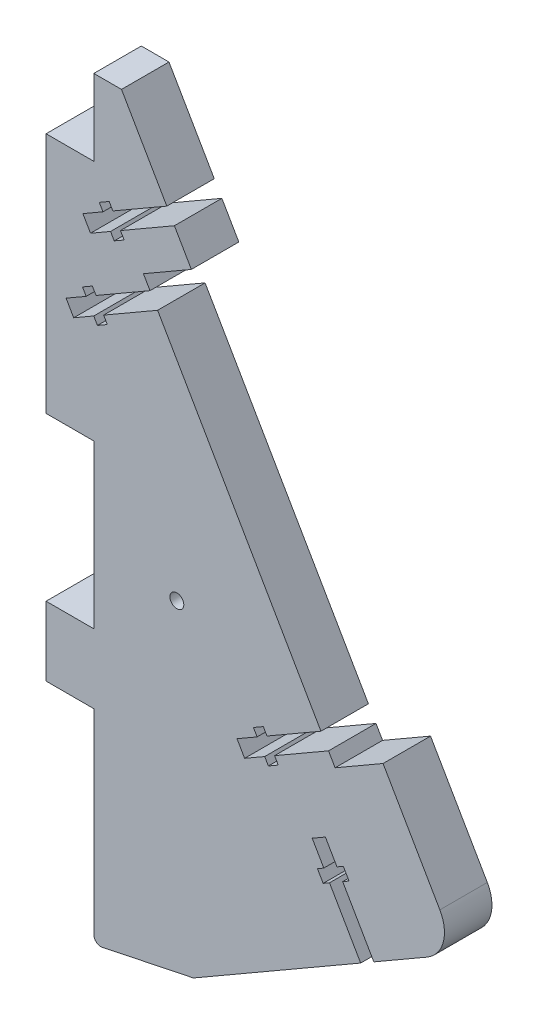
from build123d import *

# Parameters (mm, degrees)
SKETCH1_W                = 100
SKETCH1_H                = 110
BOSS_EXTRUDE1_DEPTH      = 6.86
BOSS_EXTRUDE2_DEPTH      = 6.86
CUT_EXTRUDE1_DEPTH       = 84.419927529
CUT_EXTRUDE1_DEPTH_BACK  = 84.419927529
CUT_EXTRUDE5_DEPTH       = 84.419927529
CUT_EXTRUDE6_DEPTH       = 84.419927529
SKETCH7_W                = 42
SKETCH7_H                = 3.55
CUT_EXTRUDE7_DEPTH       = 84.419927529
SKETCH8_W                = 5
SKETCH8_H                = 7.62
CUT_EXTRUDE8_DEPTH       = 84.419927529
CUT_EXTRUDE9_DEPTH       = 84.419927529
LPATTERN1_COUNT          = 2
LPATTERN1_PITCH          = 49.4
SKETCH15_W               = 6.5
SKETCH15_H               = 9.5
BOSS_EXTRUDE3_DEPTH      = 6.86
CUT_EXTRUDE14_START      = -6.86
CUT_EXTRUDE14_DEPTH      = 6.86
BOSS_EXTRUDE4_DEPTH      = 6.86
FILLET3_R                = 5
FILLET4_R                = 7
CUT_EXTRUDE11_DEPTH      = 84.419927529
BOSS_EXTRUDE5_DEPTH      = 6.86
BOSS_EXTRUDE6_DEPTH      = 6.86
CUT_EXTRUDE12_DEPTH      = 84.419927529
CUT_EXTRUDE12_DEPTH_BACK = 84.419927529
SKETCH22_R               = 1
CUT_EXTRUDE13_DEPTH      = 84.419927529
CUT_EXTRUDE15_DEPTH      = 84.419927529
CUT_EXTRUDE15_DEPTH_BACK = 84.419927529
CUT_EXTRUDE16_DEPTH      = 84.419927529
CUT_EXTRUDE16_DEPTH_BACK = 84.419927529
FILLET2_R                = 1
BOSS_EXTRUDE8_START      = -6.86
BOSS_EXTRUDE8_DEPTH      = 6.86
CUT_EXTRUDE19_START      = -10
CUT_EXTRUDE19_DEPTH      = 10
SKETCH28_W               = 6.86
SKETCH28_H               = 9.5
SKETCH28_H_2             = 35
BOSS_EXTRUDE9_DEPTH      = 0.4
BOSS_EXTRUDE10_REACH     = 81.915
SKETCH29_W               = 6.86
SKETCH29_H               = 0.5
BOSS_EXTRUDE11_DEPTH     = 6.86


# Read off the part's stored shape, not the designer's step: Cut-Extrude14
with BuildPart() as part:
    # Sketch1 → Boss-Extrude1 (new body)
    with BuildSketch(Plane.XY):
        Rectangle(SKETCH1_W, SKETCH1_H)
    extrude(amount=BOSS_EXTRUDE1_DEPTH)

    # Sketch14 → Boss-Extrude2 (add)
    with BuildSketch(Plane.XY.offset(6.86)):
        with BuildLine():
            Line((-50, 44), (-56.9, 44))
            Line((-56.9, 44), (-57.252653961, 46))
            Line((-57.252653961, 46), (-60.252653961, 46))
            ThreePointArc((-60.252653961, 46), (-62.140394827, 27.177051725), (-56.9, 9))
            Line((-56.9, 9), (-50, 9))
            Line((-50, 9), (-50, 44))
        make_face()
    extrude(amount=-BOSS_EXTRUDE2_DEPTH)

    # Sketch9 → Cut-Extrude1 (cut, two sides: drawn at the far end of the back side and taken through both)
    with BuildSketch(Plane.XY.offset(6.86).offset(-CUT_EXTRUDE1_DEPTH_BACK)):
        Polygon((-202.691345573, 326.397371639), (-46, 55), (2.5, -29.004464167), (-49.825975731, -59.214880341), (-321.22334737, -215.906225914), (291.08659924, -349.739606366), (409.618601037, 192.563991188), align=None)
    extrude(amount=CUT_EXTRUDE1_DEPTH + CUT_EXTRUDE1_DEPTH_BACK, mode=Mode.SUBTRACT)

    # Sketch11 → Cut-Extrude5 (cut, through all)
    with BuildSketch(Plane.XY.offset(6.86)):
        Polygon((-35.90593882, 37.516573181), (-8.20593882, -10.461234188), (-15.13414205, -14.461234188), (-42.83414205, 33.516573181), align=None)
    extrude(amount=-CUT_EXTRUDE5_DEPTH, mode=Mode.SUBTRACT)

    # Sketch12 → Cut-Extrude6 (cut, through all)
    with BuildSketch(Plane.XY.offset(6.86)):
        Polygon((-18.88414205, -7.96604366), (-21.534179786, -9.49604366), (-35.534179786, 14.752667646), (-32.88414205, 16.282667646), align=None)
    extrude(amount=-CUT_EXTRUDE6_DEPTH, mode=Mode.SUBTRACT)

    # Sketch7 → Cut-Extrude7 (cut, through all)
    with BuildSketch(Plane.XY.offset(6.86)):
        with Locations((-50, -34)):
            Rectangle(SKETCH7_W, SKETCH7_H)
    extrude(amount=-CUT_EXTRUDE7_DEPTH, mode=Mode.SUBTRACT)

    # Sketch8 → Cut-Extrude8 (cut, through all)
    with BuildSketch(Plane.XY.offset(6.86)):
        with Locations((-36.5, -34)):
            Rectangle(SKETCH8_W, SKETCH8_H)
    extrude(amount=-CUT_EXTRUDE8_DEPTH, mode=Mode.SUBTRACT)

    # Sketch13 → Cut-Extrude9 (cut, through all)
    with BuildSketch(Plane.XY.offset(6.86)):
        Polygon((-41.88414205, 31.871124914), (-40.78414205, 29.965869026), (-48.578370684, 25.465869026), (-48.048870684, 24.548748123), (-49.478678626, 23.723248123), (-50.008178626, 24.640369026), (-52.908497703, 22.965869026), (-54.008497703, 24.871124914), (-51.108178626, 26.545624914), (-51.637678626, 27.462745817), (-50.207870684, 28.288245817), (-49.678370684, 27.371124914), align=None)
        Polygon((-39.45593882, 43.665353548), (-38.35593882, 41.76009766), (-46.150167454, 37.26009766), (-45.620667454, 36.342976757), (-47.050475396, 35.517476757), (-47.579975396, 36.43459766), (-50.480294473, 34.76009766), (-51.580294473, 36.665353548), (-48.679975396, 38.339853548), (-49.209475396, 39.256974451), (-47.779667454, 40.082474451), (-47.250167454, 39.165353548), align=None)
        Polygon((-18.443009001, -24.930108514), (-11.443009001, -37.054464167), (-9.537753113, -35.954464167), (-16.537753113, -23.830108514), align=None)
    cut_extrude9 = extrude(amount=-CUT_EXTRUDE9_DEPTH, mode=Mode.SUBTRACT)

    # LPattern1: Cut-Extrude9 ×2
    with Locations(*[Vector(0.49999999999999345, -0.8660254037844425, 0) * (i * LPATTERN1_PITCH) for i in range(1, LPATTERN1_COUNT)]):
        add(cut_extrude9, mode=Mode.SUBTRACT)

    # Sketch15 → Boss-Extrude3 (add)
    with BuildSketch(Plane.XY.offset(6.86)):
        with Locations((-53.25, -19.75)):
            Rectangle(SKETCH15_W, SKETCH15_H)
    extrude(amount=-BOSS_EXTRUDE3_DEPTH)

    # Cut-Extrude14 outline → Cut-Extrude14 (cut)
    with BuildSketch(Plane.XY.offset(6.86).offset(CUT_EXTRUDE14_START)):
        Polygon((-56.5, -15), (-56.5, -16.500643242), (-50, -15), align=None)
    extrude(amount=CUT_EXTRUDE14_DEPTH, mode=Mode.SUBTRACT)

    # Sketch16 → Boss-Extrude4 (add)
    with BuildSketch(Plane.XY.offset(6.86)):
        Polygon((-35.605117767, -51.004464167), (-34.105117767, -53.602540378), (-36.525588833, -55), (-42.525588833, -55), (-44.558274136, -51.479285778), align=None)
    extrude(amount=-BOSS_EXTRUDE4_DEPTH)

    # Fillet3
    fillet3_edges = [part.edges().sort_by_distance(p)[0] for p in [
        (2.5, -29.004464167, 3.43),
    ]]
    fillet(fillet3_edges, radius=FILLET3_R)

    # Fillet4
    fillet4_edges = [part.edges().sort_by_distance(p)[0] for p in [
        (-56.9, 9, 3.43),
    ]]
    fillet(fillet4_edges, radius=FILLET4_R)

    # Sketch18 → Cut-Extrude11 (cut, through all)
    with BuildSketch(Plane.XY.offset(6.86)):
        Polygon((-17.686495929, -28.360427591), (-13.945266185, -26.200427591), (-13.119766185, -27.630235533), (-16.860995929, -29.790235533), align=None)
    extrude(amount=-CUT_EXTRUDE11_DEPTH, mode=Mode.SUBTRACT)

    # Sketch19 → Boss-Extrude5 (add)
    with BuildSketch(Plane.XY.offset(6.86)):
        Polygon((-24.334179786, -4.646301399), (-23.234179786, -6.551557287), (-25.780294473, -8.021557287), (-26.880294473, -6.116301399), align=None)
    extrude(amount=-BOSS_EXTRUDE5_DEPTH)

    # Sketch20 → Boss-Extrude6 (add)
    with BuildSketch(Plane.XY.offset(6.86)):
        Polygon((-32.88414205, 16.282667646), (-18.88414205, -7.96604366), (-23.822038778, -10.816939665), (-37.822038778, 13.431771641), align=None)
    extrude(amount=-BOSS_EXTRUDE6_DEPTH)

    # Sketch21 → Cut-Extrude12 (cut, two sides: drawn at the far end of the back side and taken through both)
    with BuildSketch(Plane.XY.offset(6.86).offset(-CUT_EXTRUDE12_DEPTH_BACK)):
        Polygon((-50, 55), (-50, 44), (-48.060403212, 55), align=None)
    extrude(amount=CUT_EXTRUDE12_DEPTH + CUT_EXTRUDE12_DEPTH_BACK, mode=Mode.SUBTRACT)

    # Sketch22 → Cut-Extrude13 (cut, through all)
    with BuildSketch(Plane.XY.offset(6.86)):
        with Locations((-38, -5)):
            Circle(SKETCH22_R)
    extrude(amount=-CUT_EXTRUDE13_DEPTH, mode=Mode.SUBTRACT)

    # Sketch24 → Cut-Extrude15 (cut, two sides: drawn at the far end of the back side and taken through both)
    with BuildSketch(Plane.XY.offset(6.86).offset(-CUT_EXTRUDE15_DEPTH_BACK)):
        Polygon((207.425051562, 16.452548282), (-35.605117767, -51.004464167), (-50, -55), (-293.030169328, -122.457012449), (-158.11614443, -608.517351106), (342.33907646, -469.607790375), align=None)
    extrude(amount=CUT_EXTRUDE15_DEPTH + CUT_EXTRUDE15_DEPTH_BACK, mode=Mode.SUBTRACT)

    # Sketch26 → Cut-Extrude16 (cut, two sides: drawn at the far end of the back side and taken through both)
    with BuildSketch(Plane.XY.offset(6.86).offset(-CUT_EXTRUDE16_DEPTH_BACK)):
        Polygon((209.546353054, 0.01089), (-35.605117767, -51.004464167), (-50, -54), (-295.15147082, -105.015354167), (-193.120762486, -595.318295807), (311.577061387, -490.29205164), align=None)
    extrude(amount=CUT_EXTRUDE16_DEPTH + CUT_EXTRUDE16_DEPTH_BACK, mode=Mode.SUBTRACT)

    # Fillet2
    fillet2_edges = [part.edges().sort_by_distance(p)[0] for p in [
        (-60.252653961, 46, 3.43),
        (-56.5, -24.5, 3.43),
        (-56.5, -16.500643242, 3.43),
        (-50, -54, 3.43),
    ]]
    fillet(fillet2_edges, radius=FILLET2_R)

    # Sketch27 → Boss-Extrude8 (add)
    with BuildSketch(Plane.XY.offset(6.86).offset(BOSS_EXTRUDE8_START)):
        with BuildLine():
            Line((-55.724951054, -16.321709094), (-50, -15))
            Line((-50, -15), (-56.5, -15))
            Line((-56.5, -15), (-56.5, -17.296079159))
            ThreePointArc((-56.5, -17.296079159), (-56.282608157, -16.673564522), (-55.724951054, -16.321709094))
        make_face()
        with BuildLine():
            ThreePointArc((-52.380008746, 9), (-54.54635817, 9.343654894), (-56.5, 10.340877094))
            Line((-56.5, 10.340877094), (-56.5, 9))
            Line((-56.5, 9), (-52.380008746, 9))
        make_face()
        with BuildLine():
            Line((-56.5, -24.5), (-55.5, -24.5))
            ThreePointArc((-55.5, -24.5), (-56.207106781, -24.207106781), (-56.5, -23.5))
            Line((-56.5, -23.5), (-56.5, -24.5))
        make_face()
    extrude(amount=BOSS_EXTRUDE8_DEPTH)

    # Sketch27<5> → Cut-Extrude19 (cut)
    with BuildSketch(Plane.XY.offset(6.86).offset(CUT_EXTRUDE19_START)):
        with BuildLine():
            Line((-56.5, 10.340877094), (-56.5, 44))
            Line((-56.5, 44), (-56.9, 44))
            Line((-56.9, 44), (-57.252653961, 46))
            Line((-57.252653961, 46), (-59.50182182, 46))
            ThreePointArc((-59.50182182, 46), (-60.105291207, 45.797386167), (-60.464218102, 45.271649399))
            ThreePointArc((-60.464218102, 45.271649399), (-62.283923616, 29.230647449), (-58.897432775, 13.445947531))
            ThreePointArc((-58.897432775, 13.445947531), (-57.920678072, 11.722035132), (-56.5, 10.340877094))
        make_face()
    extrude(amount=CUT_EXTRUDE19_DEPTH, mode=Mode.SUBTRACT)

    # Sketch28 → Boss-Extrude9 (add)
    with BuildSketch(Plane.ZY.offset(56.5)):
        with Locations((3.43, -19.75)):
            Rectangle(SKETCH28_W, SKETCH28_H)
        with Locations((3.43, 26.5)):
            Rectangle(SKETCH28_W, SKETCH28_H_2)
    extrude(amount=BOSS_EXTRUDE9_DEPTH)

    # Sketch29 → Boss-Extrude10 (add, up to next)
    with BuildSketch(Plane.ZY.offset(56.9), mode=Mode.PRIVATE) as boss_extrude10_sk1:
        with Locations((3.43, -14.75)):
            Rectangle(SKETCH29_W, SKETCH29_H)
    boss_extrude10_tool1 = extrude(boss_extrude10_sk1.sketch, amount=-BOSS_EXTRUDE10_REACH, mode=Mode.PRIVATE) - part.part
    add(boss_extrude10_tool1.solids().sort_by_distance((-56.9, -14.75, 3.43))[0])

    # Sketch30 → Boss-Extrude11 (add)
    with BuildSketch(Plane.XY.offset(6.86)):
        Polygon((-39, -32.225), (-50, -32.225), (-50, -35.775), (-39, -35.775), (-39, -37.81), (-34, -37.81), (-34, -35.775), (-29, -35.775), (-29, -32.225), (-34, -32.225), (-34, -30.19), (-39, -30.19), align=None)
        Polygon((-50, 55), (-48.060403212, 55), (-50, 44), align=None)
    extrude(amount=-BOSS_EXTRUDE11_DEPTH)


solid = part.part
